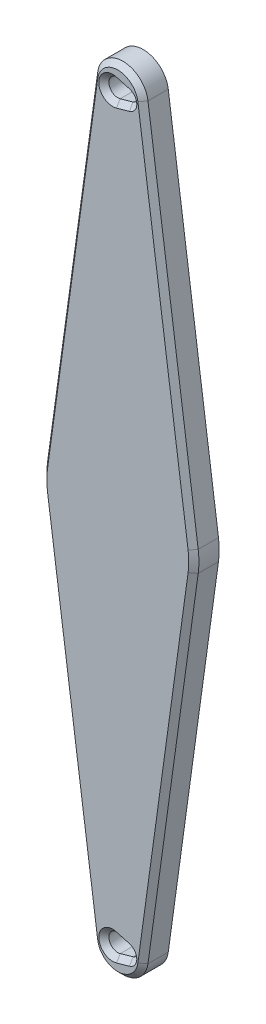
from build123d import *

# Parameters (mm, degrees)
BOSS_EXTRUDE1_DEPTH      = 5
CHAMFER1_SIZE            = 1
CUT_EXTRUDE2_REACH       = 179.034
CHAMFER3_SIZE            = 1
CHAMFER3_OF_MIRROR2_SIZE = 1


with BuildPart() as part:
    # Sketch1 → Boss-Extrude1 (new body)
    with BuildSketch(Plane.XY):
        with BuildLine():
            ThreePointArc((99.858594129, 65.945205479), (100, 68), (99.858594129, 70.054794521))
            Line((99.858594129, 70.054794521), (89.95286471, 141.684931507))
            ThreePointArc((89.95286471, 141.684931507), (85, 146), (80.04713529, 141.684931507))
            Line((80.04713529, 141.684931507), (70.141405871, 70.054794521))
            ThreePointArc((70.141405871, 70.054794521), (70, 68), (70.141405871, 65.945205479))
            Line((70.141405871, 65.945205479), (80.04713529, -5.684931507))
            ThreePointArc((80.04713529, -5.684931507), (85, -10), (89.95286471, -5.684931507))
            Line((89.95286471, -5.684931507), (99.858594129, 65.945205479))
        make_face()
    extrude(amount=BOSS_EXTRUDE1_DEPTH)

    # Chamfer1
    chamfer1_edges = [part.edges().sort_by_distance(p)[0] for p in [
        (75.094270581, 30.130136986, 5),
        (70, 68, 5),
        (75.094270581, 105.869863014, 5),
        (85, 146, 5),
        (94.905729419, 105.869863014, 5),
        (100, 68, 5),
        (94.905729419, 30.130136986, 5),
        (85, -10, 5),
    ]]
    chamfer(chamfer1_edges, length=CHAMFER1_SIZE)

    # Sketch6 → Cut-Extrude2 (cut, up to next)
    with BuildSketch(Plane.XY.offset(5), mode=Mode.PRIVATE) as cut_extrude2_sk1:
        with BuildLine():
            Line((84.477272727, 139.316340075), (87.022727273, 140.037908614))
            ThreePointArc((87.022727273, 140.037908614), (87.75, 141), (87.022727273, 141.962091386))
            Line((87.022727273, 141.962091386), (84.477272727, 142.683659925))
            ThreePointArc((84.477272727, 142.683659925), (82.25, 141), (84.477272727, 139.316340075))
        make_face()
    cut_extrude2_tool1 = extrude(cut_extrude2_sk1.sketch, amount=-CUT_EXTRUDE2_REACH, mode=Mode.PRIVATE) & part.part
    cut_extrude2 = cut_extrude2_tool1.solids().sort_by_distance((84.791234, 141, 5))[0]
    add(cut_extrude2, mode=Mode.SUBTRACT)

    # Chamfer3
    chamfer3_edges = [part.edges().sort_by_distance(p)[0] for p in [
        (85.75, 139.677124344, 0),
        (87.75, 141, 0),
        (82.25, 141, 0),
        (85.75, 142.322875656, 0),
        (87.75, 141, 5),
        (85.75, 139.677124344, 5),
        (82.25, 141, 5),
        (85.75, 142.322875656, 5),
    ]]
    chamfer(chamfer3_edges, length=CHAMFER3_SIZE)

    # Mirror2: Cut-Extrude2 across plane
    add(cut_extrude2.mirror(Plane(origin=(0, 68, 0), x_dir=(0, -3.1724622928663687e-12, 1.0), z_dir=(0, -1.0, -3.1724622928663687e-12))), mode=Mode.SUBTRACT)

    # Chamfer3 of Mirror2
    chamfer3_of_mirror2_edges = [part.edges().sort_by_distance(p)[0] for p in [
        (85.75, -3.677124344, 0),
        (87.75, -5, 0),
        (82.25, -5, 0),
        (85.75, -6.322875656, 0),
        (87.75, -5, 5),
        (85.75, -3.677124344, 5),
        (82.25, -5, 5),
        (85.75, -6.322875656, 5),
    ]]
    chamfer(chamfer3_of_mirror2_edges, length=CHAMFER3_OF_MIRROR2_SIZE)


solid = part.part
